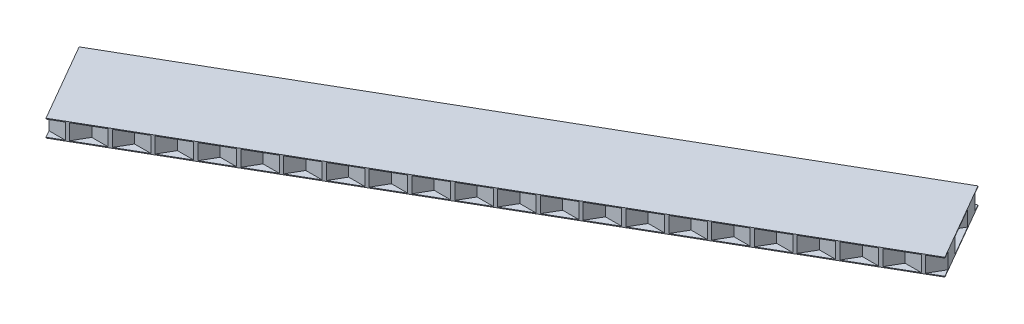
from build123d import *

# Parameters (mm, degrees)
EXTRUDE_THIN1_DEPTH      = 10
BOSS_EXTRUDE1_DEPTH      = 30
BOSS_EXTRUDE1_DEPTH_BACK = 260
SKETCH5_W                = 413.071076938
SKETCH5_H                = 0.5
SKETCH5_W_2              = 415.172711849
CUT_EXTRUDE2_DEPTH       = 250
CUT_EXTRUDE2_DEPTH_BACK  = 250
SKETCH4_W                = 1204.671417947
SKETCH4_H                = 628.870321704


# Read off the part's stored shape, not the designer's step: Extrude-Thin1
with BuildPart() as part:
    # Extrude-Thin1 outline → Extrude-Thin1 (new body)
    with BuildSketch(Plane(origin=(0, 0, 0), x_dir=(1, 0, 0), z_dir=(0, 1, 0))):
        Polygon((-29.444863729, 30), (-23.382685902, 19.5), (-11.835680518, 19.5), (-6.350852961, 10), (-12.124355653, 0), (-6.062177826, -10.5), (6.062177826, -10.5), (11.835680518, -0.5), (23.382685902, -0.5), (29.156188594, 9.5), (40.703193978, 9.5), (46.47669667, 19.5), (58.023702054, 19.5), (63.797204745, 29.5), (75.344210129, 29.5), (81.117712821, 39.5), (92.664718205, 39.5), (98.438220897, 49.5), (109.985226281, 49.5), (115.758728973, 59.5), (127.305734356, 59.5), (133.079237048, 69.5), (144.626242432, 69.5), (150.399745124, 79.5), (161.946750508, 79.5), (167.7202532, 89.5), (179.267258583, 89.5), (185.040761275, 99.5), (196.587766659, 99.5), (202.361269351, 109.5), (213.908274735, 109.5), (219.681777427, 119.5), (231.22878281, 119.5), (237.002285502, 129.5), (248.549290886, 129.5), (254.322793578, 139.5), (265.869798962, 139.5), (271.643301654, 149.5), (283.190307038, 149.5), (288.963809729, 159.5), (300.510815113, 159.5), (306.284317805, 169.5), (317.831323189, 169.5), (323.604825881, 179.5), (335.151831265, 179.5), (340.925333956, 189.5), (352.47233934, 189.5), (358.534517167, 200), (352.47233934, 210.5), (340.925333956, 210.5), (335.440506399, 220), (341.214009091, 230), (335.151831265, 240.5), (323.027475612, 240.5), (317.25397292, 230.5), (305.706967536, 230.5), (299.933464844, 220.5), (288.38645946, 220.5), (282.612956768, 210.5), (271.065951385, 210.5), (265.292448693, 200.5), (253.745443309, 200.5), (247.971940617, 190.5), (236.424935233, 190.5), (230.651432541, 180.5), (219.104427157, 180.5), (213.330924466, 170.5), (201.783919082, 170.5), (196.01041639, 160.5), (184.463411006, 160.5), (178.689908314, 150.5), (167.14290293, 150.5), (161.369400239, 140.5), (149.822394855, 140.5), (144.048892163, 130.5), (132.501886779, 130.5), (126.728384087, 120.5), (115.181378703, 120.5), (109.407876011, 110.5), (97.860870628, 110.5), (92.087367936, 100.5), (80.540362552, 100.5), (74.76685986, 90.5), (63.219854476, 90.5), (57.446351784, 80.5), (45.899346401, 80.5), (40.125843709, 70.5), (28.578838325, 70.5), (22.805335633, 60.5), (11.258330249, 60.5), (5.484827557, 50.5), (-6.062177826, 50.5), (-11.835680518, 40.5), (-23.382685902, 40.5), align=None)
        Polygon((5.484827557, 9.5), (10.969655115, 0), (5.484827557, -9.5), (-5.484827557, -9.5), (-10.969655115, 0), (-5.484827557, 9.5), align=None, mode=Mode.SUBTRACT)
        Polygon((22.805335633, 19.5), (28.29016319, 10), (22.805335633, 0.5), (11.835680518, 0.5), (6.350852961, 10), (11.835680518, 19.5), align=None, mode=Mode.SUBTRACT)
        Polygon((-10.969655115, 20), (-5.484827557, 29.5), (5.484827557, 29.5), (10.969655115, 20), (5.484827557, 10.5), (-5.484827557, 10.5), align=None, mode=Mode.SUBTRACT)
        Polygon((29.156188594, 29.5), (40.125843709, 29.5), (45.610671266, 20), (40.125843709, 10.5), (29.156188594, 10.5), (23.671361037, 20), align=None, mode=Mode.SUBTRACT)
        Polygon((-11.835680518, 20.5), (-22.805335633, 20.5), (-28.29016319, 30), (-22.805335633, 39.5), (-11.835680518, 39.5), (-6.350852961, 30), align=None, mode=Mode.SUBTRACT)
        Polygon((28.29016319, 30), (22.805335633, 20.5), (11.835680518, 20.5), (6.350852961, 30), (11.835680518, 39.5), (22.805335633, 39.5), align=None, mode=Mode.SUBTRACT)
        Polygon((-5.484827557, 30.5), (-10.969655115, 40), (-5.484827557, 49.5), (5.484827557, 49.5), (10.969655115, 40), (5.484827557, 30.5), align=None, mode=Mode.SUBTRACT)
        Polygon((11.835680518, 59.5), (22.805335633, 59.5), (28.29016319, 50), (22.805335633, 40.5), (11.835680518, 40.5), (6.350852961, 50), align=None, mode=Mode.SUBTRACT)
        Polygon((46.47669667, 39.5), (57.446351784, 39.5), (62.931179342, 30), (57.446351784, 20.5), (46.47669667, 20.5), (40.991869112, 30), align=None, mode=Mode.SUBTRACT)
        Polygon((45.610671266, 40), (40.125843709, 30.5), (29.156188594, 30.5), (23.671361037, 40), (29.156188594, 49.5), (40.125843709, 49.5), align=None, mode=Mode.SUBTRACT)
        Polygon((57.446351784, 59.5), (62.931179342, 50), (57.446351784, 40.5), (46.47669667, 40.5), (40.991869112, 50), (46.47669667, 59.5), align=None, mode=Mode.SUBTRACT)
        Polygon((74.76685986, 49.5), (80.251687417, 40), (74.76685986, 30.5), (63.797204745, 30.5), (58.312377188, 40), (63.797204745, 49.5), align=None, mode=Mode.SUBTRACT)
        Polygon((92.087367936, 59.5), (97.572195493, 50), (92.087367936, 40.5), (81.117712821, 40.5), (75.632885264, 50), (81.117712821, 59.5), align=None, mode=Mode.SUBTRACT)
        Polygon((40.125843709, 69.5), (45.610671266, 60), (40.125843709, 50.5), (29.156188594, 50.5), (23.671361037, 60), (29.156188594, 69.5), align=None, mode=Mode.SUBTRACT)
        Polygon((57.446351784, 79.5), (62.931179342, 70), (57.446351784, 60.5), (46.47669667, 60.5), (40.991869112, 70), (46.47669667, 79.5), align=None, mode=Mode.SUBTRACT)
        Polygon((74.76685986, 69.5), (80.251687417, 60), (74.76685986, 50.5), (63.797204745, 50.5), (58.312377188, 60), (63.797204745, 69.5), align=None, mode=Mode.SUBTRACT)
        Polygon((109.407876011, 69.5), (114.892703569, 60), (109.407876011, 50.5), (98.438220897, 50.5), (92.95339334, 60), (98.438220897, 69.5), align=None, mode=Mode.SUBTRACT)
        Polygon((92.087367936, 79.5), (97.572195493, 70), (92.087367936, 60.5), (81.117712821, 60.5), (75.632885264, 70), (81.117712821, 79.5), align=None, mode=Mode.SUBTRACT)
        Polygon((74.76685986, 89.5), (80.251687417, 80), (74.76685986, 70.5), (63.797204745, 70.5), (58.312377188, 80), (63.797204745, 89.5), align=None, mode=Mode.SUBTRACT)
        Polygon((114.892703569, 80), (109.407876011, 70.5), (98.438220897, 70.5), (92.95339334, 80), (98.438220897, 89.5), (109.407876011, 89.5), align=None, mode=Mode.SUBTRACT)
        Polygon((115.758728973, 79.5), (126.728384087, 79.5), (132.213211644, 70), (126.728384087, 60.5), (115.758728973, 60.5), (110.273901415, 70), align=None, mode=Mode.SUBTRACT)
        Polygon((144.048892163, 89.5), (149.53371972, 80), (144.048892163, 70.5), (133.079237048, 70.5), (127.594409491, 80), (133.079237048, 89.5), align=None, mode=Mode.SUBTRACT)
        Polygon((92.087367936, 99.5), (97.572195493, 90), (92.087367936, 80.5), (81.117712821, 80.5), (75.632885264, 90), (81.117712821, 99.5), align=None, mode=Mode.SUBTRACT)
        Polygon((109.407876011, 109.5), (114.892703569, 100), (109.407876011, 90.5), (98.438220897, 90.5), (92.95339334, 100), (98.438220897, 109.5), align=None, mode=Mode.SUBTRACT)
        Polygon((132.213211644, 90), (126.728384087, 80.5), (115.758728973, 80.5), (110.273901415, 90), (115.758728973, 99.5), (126.728384087, 99.5), align=None, mode=Mode.SUBTRACT)
        Polygon((161.369400239, 99.5), (166.854227796, 90), (161.369400239, 80.5), (150.399745124, 80.5), (144.914917567, 90), (150.399745124, 99.5), align=None, mode=Mode.SUBTRACT)
        Polygon((144.048892163, 109.5), (149.53371972, 100), (144.048892163, 90.5), (133.079237048, 90.5), (127.594409491, 100), (133.079237048, 109.5), align=None, mode=Mode.SUBTRACT)
        Polygon((126.728384087, 119.5), (132.213211644, 110), (126.728384087, 100.5), (115.758728973, 100.5), (110.273901415, 110), (115.758728973, 119.5), align=None, mode=Mode.SUBTRACT)
        Polygon((166.854227796, 110), (161.369400239, 100.5), (150.399745124, 100.5), (144.914917567, 110), (150.399745124, 119.5), (161.369400238, 119.5), align=None, mode=Mode.SUBTRACT)
        Polygon((178.689908314, 109.5), (184.174735871, 100), (178.689908314, 90.5), (167.7202532, 90.5), (162.235425642, 100), (167.7202532, 109.5), align=None, mode=Mode.SUBTRACT)
        Polygon((185.040761275, 119.5), (196.01041639, 119.5), (201.495243947, 110), (196.01041639, 100.5), (185.040761275, 100.5), (179.555933718, 110), align=None, mode=Mode.SUBTRACT)
        Polygon((144.048892163, 129.5), (149.53371972, 120), (144.048892163, 110.5), (133.079237048, 110.5), (127.594409491, 120), (133.079237048, 129.5), align=None, mode=Mode.SUBTRACT)
        Polygon((161.369400239, 139.5), (166.854227796, 130), (161.369400239, 120.5), (150.399745124, 120.5), (144.914917567, 130), (150.399745124, 139.5), align=None, mode=Mode.SUBTRACT)
        Polygon((184.174735871, 120), (178.689908314, 110.5), (167.7202532, 110.5), (162.235425642, 120), (167.7202532, 129.5), (178.689908314, 129.5), align=None, mode=Mode.SUBTRACT)
        Polygon((213.330924466, 129.5), (218.815752023, 120), (213.330924466, 110.5), (202.361269351, 110.5), (196.876441794, 120), (202.361269351, 129.5), align=None, mode=Mode.SUBTRACT)
        Polygon((201.495243947, 130), (196.01041639, 120.5), (185.040761275, 120.5), (179.555933718, 130), (185.040761275, 139.5), (196.01041639, 139.5), align=None, mode=Mode.SUBTRACT)
        Polygon((178.689908314, 149.5), (184.174735871, 140), (178.689908314, 130.5), (167.7202532, 130.5), (162.235425642, 140), (167.7202532, 149.5), align=None, mode=Mode.SUBTRACT)
        Polygon((218.815752023, 140), (213.330924466, 130.5), (202.361269351, 130.5), (196.876441794, 140), (202.361269351, 149.5), (213.330924466, 149.5), align=None, mode=Mode.SUBTRACT)
        Polygon((230.651432541, 139.5), (236.136260099, 130), (230.651432541, 120.5), (219.681777427, 120.5), (214.196949869, 130), (219.681777427, 139.5), align=None, mode=Mode.SUBTRACT)
        Polygon((247.971940617, 149.5), (253.456768174, 140), (247.971940617, 130.5), (237.002285502, 130.5), (231.517457945, 140), (237.002285502, 149.5), align=None, mode=Mode.SUBTRACT)
        Polygon((196.01041639, 159.5), (201.495243947, 150), (196.01041639, 140.5), (185.040761275, 140.5), (179.555933718, 150), (185.040761275, 159.5), align=None, mode=Mode.SUBTRACT)
        Polygon((213.330924466, 169.5), (218.815752023, 160), (213.330924466, 150.5), (202.361269351, 150.5), (196.876441794, 160), (202.361269351, 169.5), align=None, mode=Mode.SUBTRACT)
        Polygon((230.651432541, 159.5), (236.136260099, 150), (230.651432541, 140.5), (219.681777427, 140.5), (214.196949869, 150), (219.681777427, 159.5), align=None, mode=Mode.SUBTRACT)
        Polygon((254.322793578, 159.5), (265.292448693, 159.5), (270.77727625, 150), (265.292448693, 140.5), (254.322793578, 140.5), (248.837966021, 150), align=None, mode=Mode.SUBTRACT)
        Polygon((253.456768174, 160), (247.971940617, 150.5), (237.002285502, 150.5), (231.517457945, 160), (237.002285502, 169.5), (247.971940617, 169.5), align=None, mode=Mode.SUBTRACT)
        Polygon((230.651432541, 179.5), (236.136260099, 170), (230.651432541, 160.5), (219.681777427, 160.5), (214.196949869, 170), (219.681777427, 179.5), align=None, mode=Mode.SUBTRACT)
        Polygon((265.292448693, 179.5), (270.77727625, 170), (265.292448693, 160.5), (254.322793578, 160.5), (248.837966021, 170), (254.322793578, 179.5), align=None, mode=Mode.SUBTRACT)
        Polygon((271.643301654, 169.5), (282.612956768, 169.5), (288.097784326, 160), (282.612956768, 150.5), (271.643301654, 150.5), (266.158474096, 160), align=None, mode=Mode.SUBTRACT)
        Polygon((288.963809729, 179.5), (299.933464844, 179.5), (305.418292401, 170), (299.933464844, 160.5), (288.963809729, 160.5), (283.478982172, 170), align=None, mode=Mode.SUBTRACT)
        Polygon((247.971940617, 189.5), (253.456768174, 180), (247.971940617, 170.5), (237.002285502, 170.5), (231.517457945, 180), (237.002285502, 189.5), align=None, mode=Mode.SUBTRACT)
        Polygon((265.292448693, 199.5), (270.77727625, 190), (265.292448693, 180.5), (254.322793578, 180.5), (248.837966021, 190), (254.322793578, 199.5), align=None, mode=Mode.SUBTRACT)
        Polygon((282.612956768, 189.5), (288.097784326, 180), (282.612956768, 170.5), (271.643301654, 170.5), (266.158474096, 180), (271.643301654, 189.5), align=None, mode=Mode.SUBTRACT)
        Polygon((299.933464844, 199.5), (305.418292401, 190), (299.933464844, 180.5), (288.963809729, 180.5), (283.478982172, 190), (288.963809729, 199.5), align=None, mode=Mode.SUBTRACT)
        Polygon((282.612956768, 209.5), (288.097784326, 200), (282.612956768, 190.5), (271.643301654, 190.5), (266.158474096, 200), (271.643301654, 209.5), align=None, mode=Mode.SUBTRACT)
        Polygon((317.25397292, 189.5), (322.738800477, 180), (317.25397292, 170.5), (306.284317805, 170.5), (300.799490248, 180), (306.284317805, 189.5), align=None, mode=Mode.SUBTRACT)
        Polygon((334.574480995, 199.5), (340.059308553, 190), (334.574480995, 180.5), (323.604825881, 180.5), (318.119998323, 190), (323.604825881, 199.5), align=None, mode=Mode.SUBTRACT)
        Polygon((317.25397292, 209.5), (322.738800477, 200), (317.25397292, 190.5), (306.284317805, 190.5), (300.799490248, 200), (306.284317805, 209.5), align=None, mode=Mode.SUBTRACT)
        Polygon((335.440506399, 200), (340.925333956, 209.5), (351.894989071, 209.5), (357.379816628, 200), (351.894989071, 190.5), (340.925333956, 190.5), align=None, mode=Mode.SUBTRACT)
        Polygon((288.963809729, 219.5), (299.933464844, 219.5), (305.418292401, 210), (299.933464844, 200.5), (288.963809729, 200.5), (283.478982172, 210), align=None, mode=Mode.SUBTRACT)
        Polygon((334.574480995, 219.5), (340.059308553, 210), (334.574480995, 200.5), (323.604825881, 200.5), (318.119998323, 210), (323.604825881, 219.5), align=None, mode=Mode.SUBTRACT)
        Polygon((322.738800477, 220), (317.25397292, 210.5), (306.284317805, 210.5), (300.799490248, 220), (306.284317805, 229.5), (317.25397292, 229.5), align=None, mode=Mode.SUBTRACT)
        Polygon((318.119998323, 230), (323.604825881, 239.5), (334.574480995, 239.5), (340.059308553, 230), (334.574480995, 220.5), (323.604825881, 220.5), align=None, mode=Mode.SUBTRACT)
    extrude(amount=EXTRUDE_THIN1_DEPTH)

    # Sketch5 → Boss-Extrude1 (add, two sides: drawn at the far end of the back side and taken through both)
    with BuildSketch(Plane.XY.offset(-BOSS_EXTRUDE1_DEPTH_BACK)):
        with Locations((165.748563745, -0.25)):
            Rectangle(SKETCH5_W, SKETCH5_H)
        with Locations((162.618359658, 10.25)):
            Rectangle(SKETCH5_W_2, SKETCH5_H)
    extrude(amount=BOSS_EXTRUDE1_DEPTH + BOSS_EXTRUDE1_DEPTH_BACK)

    # Sketch4 → Cut-Extrude2 (cut, two sides: drawn at the far end of the back side and taken through both)
    with BuildSketch(Plane(origin=(0, 0, 0), x_dir=(1, 0, 0), z_dir=(0, 1, 0)).offset(-CUT_EXTRUDE2_DEPTH_BACK)):
        with Locations((241.213932553, 99.129138916)):
            Rectangle(SKETCH4_W, SKETCH4_H)
        Polygon((-31.754264805, 35), (331.976404784, 245), (360.843918244, 195), (-2.886751346, -15), align=None, mode=Mode.SUBTRACT)
    extrude(amount=CUT_EXTRUDE2_DEPTH + CUT_EXTRUDE2_DEPTH_BACK, mode=Mode.SUBTRACT)


solid = part.part
